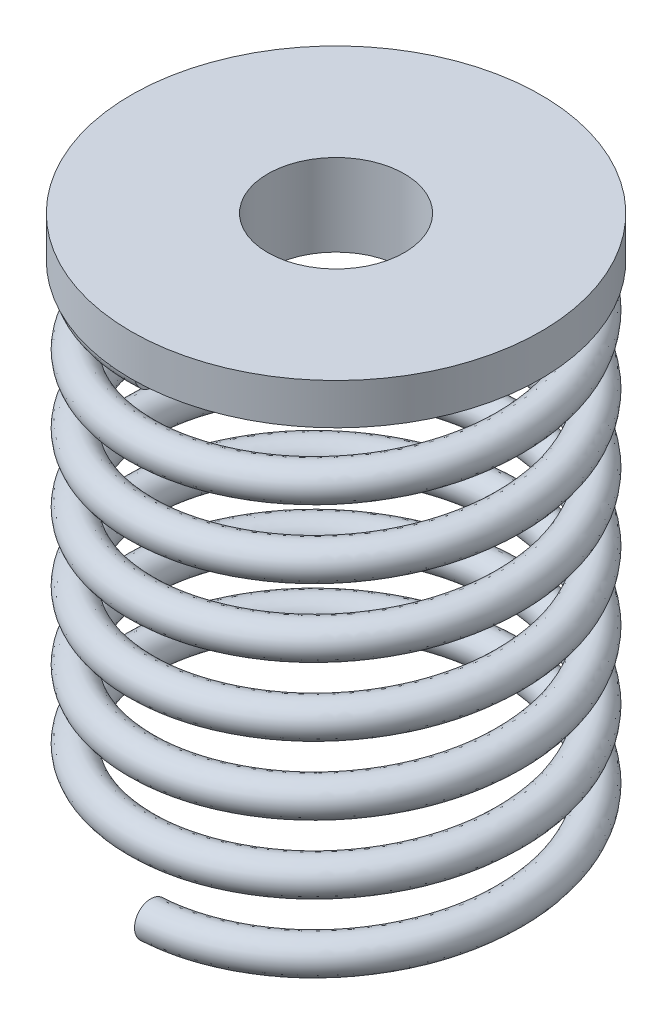
from build123d import *

# Parameters (mm, degrees)
SKETCH2_R           = 15
BOSS_EXTRUDE1_DEPTH = 3
SWEEP2_PITCH        = 5
SKETCH55_R          = 10
BOSS_EXTRUDE5_DEPTH = 6
SKETCH56_R          = 5
CUT_EXTRUDE2_DEPTH  = 9


with BuildPart() as part:
    # Sketch2 → Boss-Extrude1 (new body)
    with BuildSketch(Plane(origin=(0, 0, 0), x_dir=(1, 0, 0), z_dir=(0, 1, 0))):
        with Locations(Location((0, 0, 0), (0, 0, 270))):
            Circle(SKETCH2_R)
    extrude(amount=BOSS_EXTRUDE1_DEPTH)

    # Sweep2: the profile of Sweep2 profile screwed along a right-hand helix of 7 turns, 12 arcs to a turn; built about Z, then put on its axis
    sweep2_z = Axis((0, 0, 0), (0, 0, 1))
    sweep2_corners = [(13.5, -0.073555165, 1.247833978), (14.75, 0, 0), (13.5, 0.073555165, -1.247833978), (12.25, 0, 0)]
    with BuildLine(mode=Mode.PRIVATE) as sweep2_profile:
        ThreePointArc((13.5, -0.073555165, 1.247833978), (14.383883476, -0.052011356, 0.882351868), (14.75, 0, 0))
        ThreePointArc((14.75, 0, 0), (14.383883476, 0.052011356, -0.882351868), (13.5, 0.073555165, -1.247833978))
        ThreePointArc((13.5, 0.073555165, -1.247833978), (12.616116524, 0.052011356, -0.882351868), (12.25, 0, 0))
        ThreePointArc((12.25, 0, 0), (12.616116524, -0.052011356, 0.882351868), (13.5, -0.073555165, 1.247833978))
    sweep2_cap = Face(sweep2_profile.wire())
    sweep2_arcs = [((13.5, -0.073555165, 1.247833978), (14.75, -0.073555165, 1.247833978), (14.75, 0, 0), (1, 0.7071067811865476, 1)), ((14.75, 0, 0), (14.75, 0.073555165, -1.247833978), (13.5, 0.073555165, -1.247833978), (1, 0.7071067811865476, 1)), ((13.5, 0.073555165, -1.247833978), (12.25, 0.073555165, -1.247833978), (12.25, 0, 0), (1, 0.7071067811865476, 1)), ((12.25, 0, 0), (12.25, -0.073555165, 1.247833978), (13.5, -0.073555165, 1.247833978), (1, 0.7071067811865476, 1))]  # start, shoulder, end, weights
    sweep2_turn_angles = [0, 15, 30, 45, 60, 75, 90, 105, 120, 135, 150, 165, 180, 195, 210, 225, 240, 255, 270, 285, 300, 315, 330, 345, 360]
    sweep2_turn_weights = [1, 0.9659258262890683, 1, 0.9659258262890683, 1, 0.9659258262890683, 1, 0.9659258262890683, 1, 0.9659258262890683, 1, 0.9659258262890683, 1, 0.9659258262890683, 1, 0.9659258262890683, 1, 0.9659258262890683, 1, 0.9659258262890683, 1, 0.9659258262890683, 1, 0.9659258262890683, 1]
    sweep2_turn_sides = [Face.make_bezier_surface([[Vector(p[j][0], p[j][1], 0).rotate(sweep2_z, sweep2_turn_angles[2 * i + k]) / sweep2_turn_weights[2 * i + k] + Vector(0, 0, p[j][2] + SWEEP2_PITCH * sweep2_turn_angles[2 * i + k] / 360) for k in range(3)] for j in range(3)], [[p[3][j] * sweep2_turn_weights[2 * i + k] for k in range(3)] for j in range(3)]) for p in sweep2_arcs for i in range(12)]
    sweep2 = Plane(origin=(0, 0, 0), x_dir=(0, 0, 1), z_dir=(0, -1, 0)) * Solid(Shell([*[p.moved(Location((0, 0, SWEEP2_PITCH * i))) for i in range(7) for p in sweep2_turn_sides], sweep2_cap, sweep2_cap.rotate(sweep2_z, 2520).moved(Location((0, 0, SWEEP2_PITCH * 2520 / 360)))]))
    add(sweep2)

    # Sketch55 → Boss-Extrude5 (add)
    with BuildSketch(Plane(origin=(0, 3, 0), x_dir=(1, 0, 0), z_dir=(0, 1, 0))):
        with Locations(Location((0, 0, 0), (0, 0, 270))):
            Circle(SKETCH55_R)
    extrude(amount=-BOSS_EXTRUDE5_DEPTH)

    # Sketch56 → Cut-Extrude2 (cut)
    with BuildSketch(Plane(origin=(0, 3, 0), x_dir=(1, 0, 0), z_dir=(0, 1, 0))):
        with Locations(Location((0, 0, 0), (0, 0, 270))):
            Circle(SKETCH56_R)
    extrude(amount=-CUT_EXTRUDE2_DEPTH, mode=Mode.SUBTRACT)


solid = part.part
